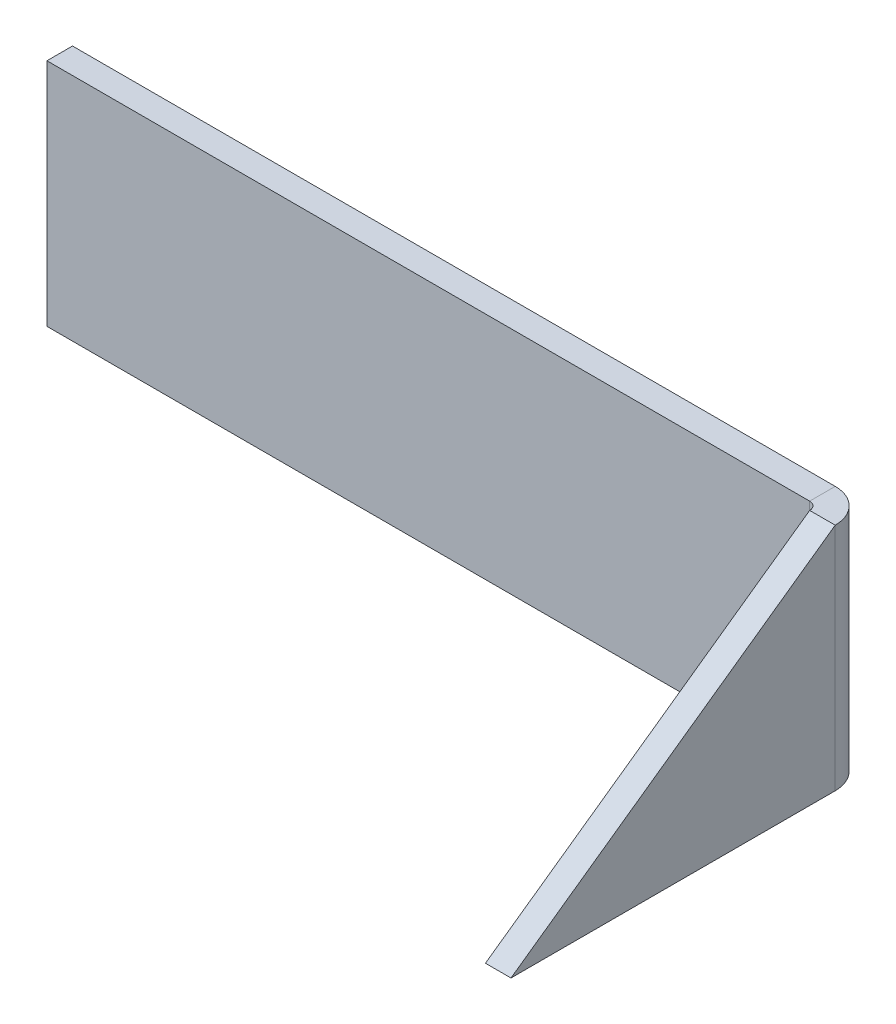
from build123d import *

# Parameters (mm, degrees)
SKETCH2_W          = 94.742
SKETCH2_H          = 28.575
BASE_FLANGE1_DEPTH = 3.175
EDGE_FLANGE1_DEPTH = 28.575
CUT_EXTRUDE2_DEPTH = 3.175


# Sheet-metal steps are written as plain solids
with BuildPart() as part:
    # Sketch2 → Base-Flange1 (new body)
    with BuildSketch(Plane.XY):
        Rectangle(SKETCH2_W, SKETCH2_H)
    extrude(amount=BASE_FLANGE1_DEPTH)

    # Edge-Flange1 section (across the edge) → Edge-Flange1 (add)
    with BuildSketch(Plane(origin=(48.371, -14.2875, 3.175), x_dir=(-1, 0, 0), z_dir=(0, 1, 0))):
        with BuildLine():
            Line((-3.175, 1), (-3.175, 41.275))
            Line((-3.175, 41.275), (0, 41.275))
            Line((0, 41.275), (0, 1))
            ThreePointArc((0, 1), (0.292893219, 0.292893219), (1, 0))
            Line((1, 0), (1, -3.175))
            ThreePointArc((1, -3.175), (-1.952170811, -1.952170811), (-3.175, 1))
        make_face()
    extrude(amount=EDGE_FLANGE1_DEPTH)

    # Sketch11 → Cut-Extrude2 (cut)
    with BuildSketch(Plane(origin=(51.546, 0, 0), x_dir=(0, 0, -1), z_dir=(1, 0, 0))):
        Polygon((-44.45, -14.2875), (-4.175, 14.2875), (-44.45, 14.2875), align=None)
    extrude(amount=-CUT_EXTRUDE2_DEPTH, mode=Mode.SUBTRACT)


solid = part.part
